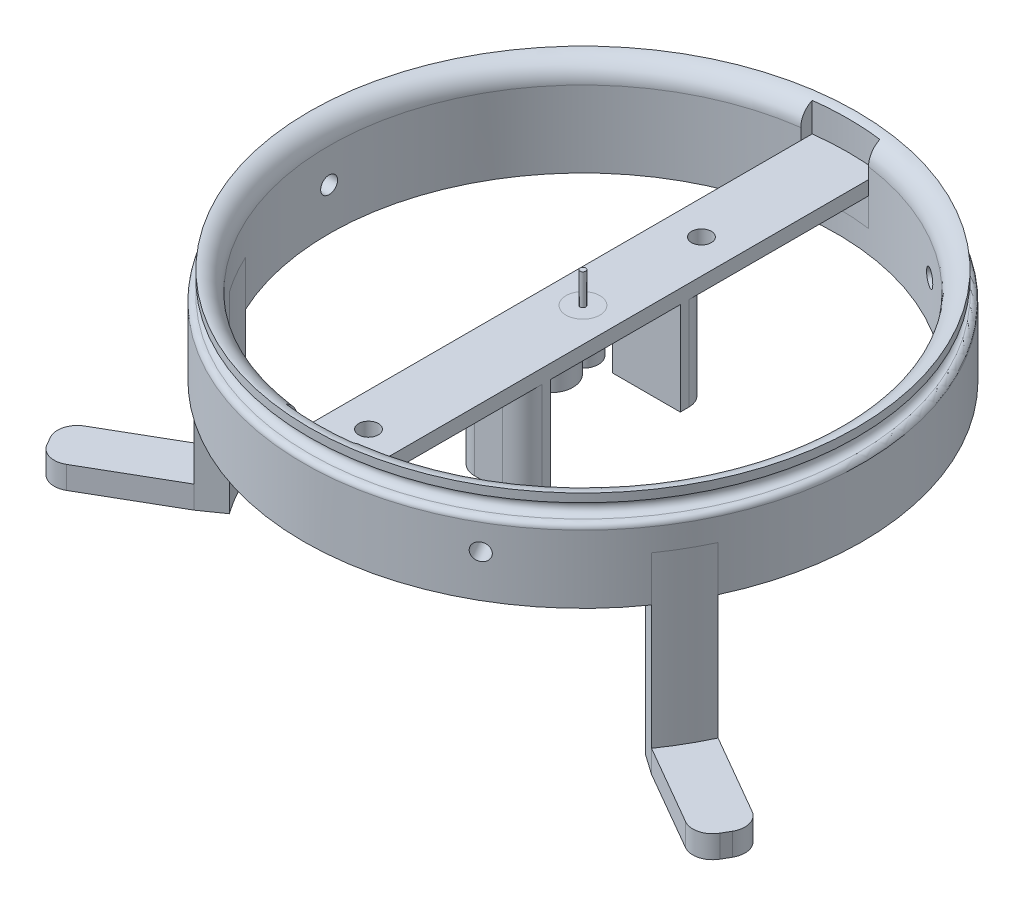
from build123d import *
from OCP.BRepAlgoAPI import BRepAlgoAPI_Cut
from OCP.TopTools import TopTools_ListOfShape

# Parameters (mm, degrees)
SKETCH4_R                = 1.5
CUT_EXTRUDE1_DEPTH       = 73.038184388
CIRPATTERN1_COUNT        = 3
BOSS_EXTRUDE1_START      = 4
BOSS_EXTRUDE1_DEPTH      = 13
INTERSECT1_START         = 4
INTERSECT1_DEPTH         = 12.66227766
INTERSECT1_2_DEPTH       = 13
INTERSECT1_3_ANGLE       = 15.324512
INTERSECT1_4_DEPTH       = 12.66227766
INTERSECT1_5_ANGLE       = 15.324512
BOSS_EXTRUDE2_START      = 9
BOSS_EXTRUDE2_DEPTH      = 2.5
SKETCH7_R                = 3
CUT_EXTRUDE3_DEPTH       = 1.25
SKETCH7_3_R              = 1.75
SKETCH7_3_R_2            = 1
CUT_EXTRUDE4_DEPTH       = 2.5
SKETCH_2832_R            = 2.75
SKETCH_2832_R_2          = 4
EXTRUDE_3265_DEPTH       = 5.2
SKETCH_3_W               = 12
SKETCH_3_H               = 5
BOSS_EXTRUDE4_DEPTH      = 16.5
BOSS_EXTRUDE4_2_DEPTH    = 16.5
FILLET3_R                = 3.5
CUT_EXTRUDE5_START       = 11.5
CUT_EXTRUDE5_DEPTH       = 61.538184486
CUT_EXTRUDE6_DEPTH       = 8
BOSS_EXTRUDE7_START      = -8
BOSS_EXTRUDE7_DEPTH      = 34
SKETCH13_W               = 8.628418532
SKETCH13_H               = 4
BOSS_EXTRUDE8_DEPTH      = 20
FILLET2_R                = 3.5
SKETCH7_4_R              = 3
SKETCH7_4_R_2            = 1
SKETCH7_4_R_3            = 0.5
BOSS_EXTRUDE9_DEPTH      = 1.25
BOSS_EXTRUDE12_START     = -7.5
BOSS_EXTRUDE12_OUTLINE_R = 1
BOSS_EXTRUDE12_DEPTH     = 6.25
SKETCH7_6_R              = 0.5
BOSS_EXTRUDE13_DEPTH     = 5.5


with BuildPart() as part:
    # Sketch2 → Revolve1 (revolve)
    with BuildSketch(Plane.XY, mode=Mode.PRIVATE) as revolve1_sk:
        with BuildLine():
            Line((-49.5, 0), (-49.5, 12))
            ThreePointArc((-49.5, 12), (-49.207106781, 12.707106781), (-48.5, 13))
            ThreePointArc((-48.5, 13), (-47.25, 14.25), (-48.5, 15.5))
            Line((-48.5, 15.5), (-48.5, 17))
            ThreePointArc((-48.5, 17), (-46.025126266, 15.974873734), (-45, 13.5))
            Line((-45, 13.5), (-45, 0))
            Line((-45, 0), (-49.5, 0))
        make_face()
    revolve(revolve1_sk.sketch.rotate(Axis((0, 0, 0), (0, 1, 0)), 270), axis=Axis((0, 0, 0), (0, 1, 0)))

    # Sketch4 → Cut-Extrude1 (cut, through all)
    with BuildSketch(Plane(origin=(0, 0, 0), x_dir=(0, 0, -1), z_dir=(1, 0, 0))):
        with Locations((0, 7.5)):
            Circle(SKETCH4_R)
    cut_extrude1 = extrude(amount=-CUT_EXTRUDE1_DEPTH, mode=Mode.SUBTRACT)

    # CirPattern1: Cut-Extrude1 ×3 about axis
    cirpattern1_axis = Axis((0, 12, 0), (0, -1, 0))
    for i in range(1, CIRPATTERN1_COUNT):
        add(cut_extrude1.rotate(cirpattern1_axis, i * 360 / CIRPATTERN1_COUNT), mode=Mode.SUBTRACT)


with BuildPart() as body_2:
    # Sketch 869 → Boss-Extrude1 (new, through all)
    with BuildSketch(Plane(origin=(0, 0, 0), x_dir=(1, 0, 0), z_dir=(0, 1, 0)).offset(BOSS_EXTRUDE1_START)):
        with BuildLine():
            Line((-6, 46.615448083), (-6, -46.615448083))
            ThreePointArc((-6, -46.615448083), (0, -47), (6, -46.615448083))
            Line((6, -46.615448083), (6, 46.615448083))
            ThreePointArc((6, 46.615448083), (0, 47), (-6, 46.615448083))
        make_face()
    extrude(amount=BOSS_EXTRUDE1_DEPTH)


with BuildPart() as intersect1_tool:
    # Intersect1: read off the stored shape, not the designer's step
    # Intersect1 outline → Intersect1 (new body)
    with BuildSketch(Plane(origin=(0, 0, 0), x_dir=(1, 0, 0), z_dir=(0, 1, 0)).offset(INTERSECT1_START)):
        with BuildLine():
            Line((-6, 46.615448083), (-6, 44.598206242))
            ThreePointArc((-6, 44.598206242), (0, 45), (6, 44.598206242))
            Line((6, 44.598206242), (6, 46.615448083))
            ThreePointArc((6, 46.615448083), (0, 47), (-6, 46.615448083))
        make_face()
        with BuildLine():
            ThreePointArc((6, -44.598206242), (0, -45), (-6, -44.598206242))
            Line((-6, -44.598206242), (-6, -46.615448083))
            ThreePointArc((-6, -46.615448083), (0, -47), (6, -46.615448083))
            Line((6, -46.615448083), (6, -44.598206242))
        make_face()
    extrude(amount=INTERSECT1_DEPTH)


with BuildPart() as part_1:
    add(part.part)

    # Intersect1: cut by intersect1_tool, with a tolerance
    intersect1_stock = TopTools_ListOfShape()
    intersect1_stock.Append(part_1.part.wrapped)
    intersect1_tools = TopTools_ListOfShape()
    intersect1_tools.Append(intersect1_tool.part.wrapped)
    intersect1_cut = BRepAlgoAPI_Cut()
    intersect1_cut.SetArguments(intersect1_stock)
    intersect1_cut.SetTools(intersect1_tools)
    intersect1_cut.SetFuzzyValue(0.00001)
    intersect1_cut.Build()
    add(Compound.cast(intersect1_cut.Shape()).solids(), mode=Mode.REPLACE)

    # Sketch 4085 → Cut-Extrude6 (cut)
    with BuildSketch(Plane.XZ):
        with BuildLine():
            Line((36.861841993, 25.810939636), (40.548026192, 28.392033599))
            ThreePointArc((40.548026192, 28.392033599), (42.868257487, 24.75), (44.862235458, 20.919603956))
            Line((44.862235458, 20.919603956), (40.783850417, 19.017821778))
            ThreePointArc((40.783850417, 19.017821778), (38.97114317, 22.5), (36.861841993, 25.810939636))
        make_face()
    cut_extrude6 = extrude(amount=-CUT_EXTRUDE6_DEPTH, mode=Mode.SUBTRACT)

    # Mirror3: Cut-Extrude6 across plane
    add(cut_extrude6.mirror(Plane(origin=(0, 0, 0), x_dir=(0, 0, 1), z_dir=(1, 0, 0))), mode=Mode.SUBTRACT)


with BuildPart() as intersect1_2_tool:
    # Intersect1 2 outline → Intersect1 2 (new body)
    with BuildSketch(Plane(origin=(0, 0, 0), x_dir=(1, 0, 0), z_dir=(0, 1, 0)).offset(INTERSECT1_START)):
        with BuildLine():
            ThreePointArc((-6, -44.598206242), (0, -45), (6, -44.598206242))
            Line((6, -44.598206242), (6, 46.615448083))
            ThreePointArc((6, 46.615448083), (0, 47), (-6, 46.615448083))
            Line((-6, 46.615448083), (-6, -44.598206242))
        make_face()
    extrude(amount=INTERSECT1_2_DEPTH)


with BuildPart() as body_2_1:
    add(body_2.part)

    # Intersect1 2: cut by intersect1_2_tool, with a tolerance
    intersect1_2_stock = TopTools_ListOfShape()
    intersect1_2_stock.Append(body_2_1.part.wrapped)
    intersect1_2_tools = TopTools_ListOfShape()
    intersect1_2_tools.Append(intersect1_2_tool.part.wrapped)
    intersect1_2_cut = BRepAlgoAPI_Cut()
    intersect1_2_cut.SetArguments(intersect1_2_stock)
    intersect1_2_cut.SetTools(intersect1_2_tools)
    intersect1_2_cut.SetFuzzyValue(0.00001)
    intersect1_2_cut.Build()
    add(Compound.cast(intersect1_2_cut.Shape()).solids(), mode=Mode.REPLACE)


with BuildPart() as intersect1_3_tool:
    # Intersect1 3 outline → Intersect1 3 (revolve)
    with BuildSketch(Plane(origin=(0, 0, 0), x_dir=(-0.13333333810571105, 0, 0.991071249179184), z_dir=(-0.991071249179184, 0, -0.13333333810571105))):
        with BuildLine():
            ThreePointArc((45, 13.5), (45.541960108, 15.370828693), (47, 16.66227766))
            Line((47, 16.66227766), (47, 17))
            Line((47, 17), (45, 17))
            Line((45, 17), (45, 13.5))
        make_face()
    revolve(axis=Axis((0, 0, 0), (0, 1, 0)), revolution_arc=INTERSECT1_3_ANGLE)


with BuildPart() as body_2_2:
    add(body_2_1.part)

    # Intersect1 3: cut by intersect1_3_tool, with a tolerance
    intersect1_3_stock = TopTools_ListOfShape()
    intersect1_3_stock.Append(body_2_2.part.wrapped)
    intersect1_3_tools = TopTools_ListOfShape()
    intersect1_3_tools.Append(intersect1_3_tool.part.wrapped)
    intersect1_3_cut = BRepAlgoAPI_Cut()
    intersect1_3_cut.SetArguments(intersect1_3_stock)
    intersect1_3_cut.SetTools(intersect1_3_tools)
    intersect1_3_cut.SetFuzzyValue(0.00001)
    intersect1_3_cut.Build()
    add(Compound.cast(intersect1_3_cut.Shape()).solids(), mode=Mode.REPLACE)


with BuildPart() as body_3:
    # Intersect1 4 outline → Intersect1 4 (new body)
    with BuildSketch(Plane(origin=(0, 0, 0), x_dir=(1, 0, 0), z_dir=(0, 1, 0)).offset(INTERSECT1_START)):
        with BuildLine():
            Line((-6, 46.615448083), (-6, 44.598206242))
            ThreePointArc((-6, 44.598206242), (0, 45), (6, 44.598206242))
            Line((6, 44.598206242), (6, 46.615448083))
            ThreePointArc((6, 46.615448083), (0, 47), (-6, 46.615448083))
        make_face()
    extrude(amount=INTERSECT1_4_DEPTH)


with BuildPart() as intersect1_5_tool:
    # Intersect1 5 outline → Intersect1 5 (revolve)
    with BuildSketch(Plane(origin=(0, 0, 0), x_dir=(0.13333333810571094, 0, -0.991071249179184), z_dir=(0.991071249179184, 0, 0.13333333810571094))):
        with BuildLine():
            Line((45, 16.66227766), (45, 13.5))
            ThreePointArc((45, 13.5), (45.541960108, 15.370828693), (47, 16.66227766))
            Line((47, 16.66227766), (45, 16.66227766))
        make_face()
    revolve(axis=Axis((0, 0, 0), (0, 1, 0)), revolution_arc=INTERSECT1_5_ANGLE)


with BuildPart() as body_3_1:
    add(body_3.part)

    # Intersect1 5: cut by intersect1_5_tool, with a tolerance
    intersect1_5_stock = TopTools_ListOfShape()
    intersect1_5_stock.Append(body_3_1.part.wrapped)
    intersect1_5_tools = TopTools_ListOfShape()
    intersect1_5_tools.Append(intersect1_5_tool.part.wrapped)
    intersect1_5_cut = BRepAlgoAPI_Cut()
    intersect1_5_cut.SetArguments(intersect1_5_stock)
    intersect1_5_cut.SetTools(intersect1_5_tools)
    intersect1_5_cut.SetFuzzyValue(0.00001)
    intersect1_5_cut.Build()
    add(Compound.cast(intersect1_5_cut.Shape()).solids(), mode=Mode.REPLACE)


with BuildPart() as body_4:
    # Вырез под продольную часть<5> → Boss-Extrude2 (new body)
    with BuildSketch(Plane(origin=(0, 0, 0), x_dir=(1, 0, 0), z_dir=(0, 1, 0)).offset(BOSS_EXTRUDE2_START)):
        with BuildLine():
            Line((-6, 46.615448083), (-6, -46.615448083))
            ThreePointArc((-6, -46.615448083), (0, -47), (6, -46.615448083))
            Line((6, -46.615448083), (6, 46.615448083))
            ThreePointArc((6, 46.615448083), (0, 47), (-6, 46.615448083))
        make_face()
    extrude(amount=BOSS_EXTRUDE2_DEPTH)

    # Sketch7 → Cut-Extrude3 (cut)
    with BuildSketch(Plane(origin=(0, 11.5, 0), x_dir=(1, 0, 0), z_dir=(0, 1, 0))):
        with Locations(Location((0, 0, 0), (0, 0, 270))):
            Circle(SKETCH7_R)
    extrude(amount=-CUT_EXTRUDE3_DEPTH, mode=Mode.SUBTRACT)

    # Sketch7<3> → Cut-Extrude4 (cut)
    with BuildSketch(Plane(origin=(0, 11.5, 0), x_dir=(1, 0, 0), z_dir=(0, 1, 0))):
        with Locations(Location((0, 21, 0), (0, 0, 270))):
            Circle(SKETCH7_3_R)
        with Locations(Location((0, -38, 0), (0, 0, 270))):
            Circle(SKETCH7_3_R)
        with Locations(Location((0, 0, 0), (0, 0, 270))):
            Circle(SKETCH7_3_R_2)
    extrude(amount=-CUT_EXTRUDE4_DEPTH, mode=Mode.SUBTRACT)


with BuildPart() as body_5:
    # Sketch 2832 → Extrude 3265 (new body)
    with BuildSketch(Plane.XZ.offset(-9)):
        Circle(SKETCH_2832_R)
        with Locations((0, 5.75)):
            Circle(SKETCH_2832_R_2)
    extrude(amount=EXTRUDE_3265_DEPTH)


with BuildPart() as body_6:
    # Низ продольной части<3> → Boss-Extrude4 (new body)
    with BuildSketch(Plane.XZ.offset(-9)):
        with Locations((0, 14.25)):
            Rectangle(SKETCH_3_W, SKETCH_3_H)
    extrude(amount=BOSS_EXTRUDE4_DEPTH)


with BuildPart() as body_7:
    # Низ продольной части<3> → Boss-Extrude4 2 (new body)
    with BuildSketch(Plane.XZ.offset(-9)):
        with Locations((0, -13.75)):
            Rectangle(SKETCH_3_W, SKETCH_3_H)
    extrude(amount=BOSS_EXTRUDE4_2_DEPTH)


with BuildPart() as body_4_1:
    add(body_4.part)

    # Combine1: union body 3, body 7, body 6, body 2
    add(body_3_1.part)
    add(body_7.part)
    add(body_6.part)
    add(body_2_2.part)

    # Fillet3
    fillet3_edges = [body_4_1.edges().sort_by_distance(p)[0] for p in [
        (6, 0.75, -16.25),
        (-6, 0.75, -16.25),
        (6, 0.75, 16.75),
        (-6, 0.75, 16.75),
    ]]
    fillet(fillet3_edges, radius=FILLET3_R)

    # Вырез под продольную часть<6> → Cut-Extrude5 (cut, through all)
    with BuildSketch(Plane(origin=(0, 0, 0), x_dir=(1, 0, 0), z_dir=(0, 1, 0)).offset(CUT_EXTRUDE5_START)):
        with BuildLine():
            Line((-6, 46.615448083), (-6, -46.615448083))
            ThreePointArc((-6, -46.615448083), (0, -47), (6, -46.615448083))
            Line((6, -46.615448083), (6, 46.615448083))
            ThreePointArc((6, 46.615448083), (0, 47), (-6, 46.615448083))
        make_face()
    extrude(amount=CUT_EXTRUDE5_DEPTH, mode=Mode.SUBTRACT)


with BuildPart() as body_4_2:
    # Вырезы<2> → Boss-Extrude7 (new body)
    with BuildSketch(Plane.XZ.offset(BOSS_EXTRUDE7_START)):
        with BuildLine():
            Line((36.861841993, 25.810939636), (40.548026192, 28.392033599))
            ThreePointArc((40.548026192, 28.392033599), (42.868257487, 24.75), (44.862235458, 20.919603956))
            Line((44.862235458, 20.919603956), (40.783850417, 19.017821778))
            ThreePointArc((40.783850417, 19.017821778), (38.97114317, 22.5), (36.861841993, 25.810939636))
        make_face()
    extrude(amount=BOSS_EXTRUDE7_DEPTH)

    # Sketch13 → Boss-Extrude8 (add)
    with BuildSketch(Plane(origin=(42.705130825, 0, 24.655818778), x_dir=(-0.5000000000000048, 0, 0.8660254037844359), z_dir=(-0.8660254037844359, 0, -0.5000000000000048))):
        with Locations((0, -24)):
            Rectangle(SKETCH13_W, SKETCH13_H)
    extrude(amount=-BOSS_EXTRUDE8_DEPTH)

    # Fillet2
    fillet2_edges = [body_4_2.edges().sort_by_distance(p)[0] for p in [
        (57.868534268, -24, 38.392033599),
        (62.182743534, -24, 30.919603956),
    ]]
    fillet(fillet2_edges, radius=FILLET2_R)


with BuildPart() as body_5_2:
    # Mirror4: mirrored copy
    add(body_4_2.part.mirror(Plane(origin=(0, 0, 0), x_dir=(0, 0, 1), z_dir=(1, 0, 0))))


with BuildPart() as body_6_2:
    # Sketch7<4> → Boss-Extrude9 (new body)
    # profile 1 of 3: a face of its own
    with BuildSketch(Plane(origin=(0, 11.5, 0), x_dir=(1, 0, 0), z_dir=(0, 1, 0))):
        with Locations(Location((0, 0, 0), (0, 0, 270))):
            Circle(SKETCH7_4_R)
        with Locations(Location((0, 0, 0), (0, 0, 270))):
            Circle(SKETCH7_4_R_2, mode=Mode.SUBTRACT)
    # profile 2 of 3: a face of its own
    with BuildSketch(Plane(origin=(0, 11.5, 0), x_dir=(1, 0, 0), z_dir=(0, 1, 0))):
        with Locations(Location((0, 0, 0), (0, 0, 270))):
            Circle(SKETCH7_4_R_2)
    # profile 3 of 3: a face of its own
    with BuildSketch(Plane(origin=(0, 11.5, 0), x_dir=(1, 0, 0), z_dir=(0, 1, 0))):
        Circle(SKETCH7_4_R_3)
    extrude(amount=-BOSS_EXTRUDE9_DEPTH)


with BuildPart() as body_7_2:
    # Boss-Extrude12: read off the stored shape, not the designer's step
    # Boss-Extrude12 outline → Boss-Extrude12 (new body)
    with BuildSketch(Plane(origin=(0, 11.5, 0), x_dir=(1, 0, 0), z_dir=(0, 1, 0)).offset(BOSS_EXTRUDE12_START)):
        Circle(BOSS_EXTRUDE12_OUTLINE_R)
    extrude(amount=BOSS_EXTRUDE12_DEPTH)


with BuildPart() as body_8:
    # Sketch7<6> → Boss-Extrude13 (new body)
    with BuildSketch(Plane(origin=(0, 11.5, 0), x_dir=(1, 0, 0), z_dir=(0, 1, 0))):
        with Locations(Location((0, 0, 0), (0, 0, 270))):
            Circle(SKETCH7_6_R)
    extrude(amount=BOSS_EXTRUDE13_DEPTH)


with BuildPart() as body_7_2_1:
    add(body_7_2.part)

    # Combine2: union body 6 2, body 8
    add(body_6_2.part)
    add(body_8.part)


solid = Compound([part_1.part, body_5.part, body_4_1.part, body_4_2.part, body_5_2.part, body_7_2_1.part])
